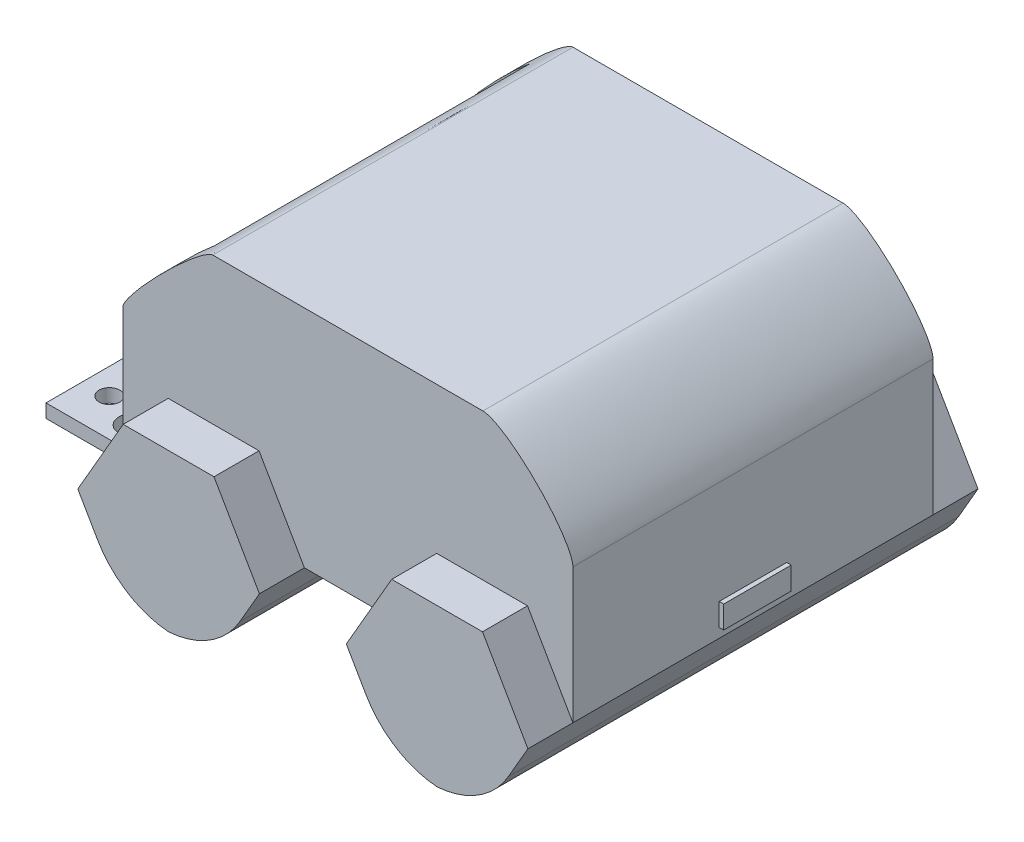
from build123d import *

# Parameters (mm, degrees)
SKETCH_1_W           = 100
SKETCH_1_H           = 80
EXTRUDE_1_DEPTH      = 50
EXTRUDE_3_DEPTH      = 10
EXTRUDE_3_DEPTH_BACK = 90
FILLET_1_SIZE        = 20
FILLET_2_R           = 20
SKETCH_7_W           = 15
SKETCH_7_H           = 5
EXTRUDE_4_DEPTH      = 1
EXTRUDE_5_DEPTH      = 10
EXTRUDE_5_DEPTH_BACK = 90
SKETCH_9_W           = 70
SKETCH_9_H           = 42
CUT_EXTRUDE_1_DEPTH  = 70
SKETCH_10_W          = 6.318012245
SKETCH_10_H          = 50
EXTRUDE_6_DEPTH      = 3
SKETCH_11_W          = 5.049227312
SKETCH_11_H          = 50
EXTRUDE_7_DEPTH      = 10
SKETCH_12_W          = 3
SKETCH_12_H          = 2
EXTRUDE_8_DEPTH      = 1
SKETCH_14_W          = 17.088208375
SKETCH_14_H          = 79.975552451
EXTRUDE_9_DEPTH      = 3
SKETCH_15_R          = 3.127439505
SKETCH_15_R_2        = 2.491358357
SKETCH_15_R_3        = 2.210086479
SKETCH_15_R_4        = 1.513903484
SKETCH_15_R_5        = 2.302487837
SKETCH_15_R_6        = 3.707833668
SKETCH_15_R_7        = 2.33587758
SKETCH_15_R_8        = 2.037847665
SKETCH_15_R_9        = 1.375167725
SKETCH_15_R_10       = 2.852513386
CUT_EXTRUDE_2_DEPTH  = 3
FILLET_7_SIZE        = 20
FILLET_8_R           = 20
EXTRUDE_10_DEPTH     = 50


with BuildPart() as part:
    # 草圖1 → 填料-伸長1 (new body)
    with BuildSketch(Plane(origin=(0, 0, 0), x_dir=(1, 0, 0), z_dir=(0, 1, 0))):
        Rectangle(SKETCH_1_W, SKETCH_1_H)
    extrude(amount=EXTRUDE_1_DEPTH)

    # 草圖4 → 填料-伸長3 (add, two sides: drawn at the far end of the back side and taken through both)
    with BuildSketch(Plane.XY.offset(40).offset(-EXTRUDE_3_DEPTH_BACK)):
        Polygon((50, 0), (39.912672295, 17.471764098), (19.738016884, 17.471764098), (9.650689179, 0), (19.738016884, -17.471764098), (39.912672295, -17.471764098), align=None)
    extrude(amount=EXTRUDE_3_DEPTH + EXTRUDE_3_DEPTH_BACK)

    # 圓角1
    # a fillet whose section is not a circle: 20 mm, written as the material it takes off along each edge
    with BuildSketch(Plane(origin=(50, 50, -90), x_dir=(0, -1, 0), z_dir=(0, 0, 1))) as fillet_1_piece_1:
        with BuildLine():
            Bezier((FILLET_1_SIZE, 0), (0, 0), (0, -FILLET_1_SIZE), weights=[1, 0.25, 1])
            Line((0, -FILLET_1_SIZE), (0, 0))
            Line((0, 0), (FILLET_1_SIZE, 0))
        make_face()
    extrude(amount=180, mode=Mode.SUBTRACT)

    # 圓角2
    # the kernel refuses this fillet: 20 mm, written as the material it takes off along each edge
    with BuildSketch(Plane(origin=(39.912672295, -17.471764098, 78.867513459), x_dir=(0.499999999999995, 0.8660254037844415, 0), z_dir=(0, 0, -1))) as fillet_2_piece_1:
        with BuildLine():
            CenterArc((FILLET_2_R * 0.57735026919, -FILLET_2_R), FILLET_2_R, 90, 60)
            Line((-FILLET_2_R * 0.288675134595, -FILLET_2_R * 0.5), (0, 0))
            Line((0, 0), (FILLET_2_R * 0.57735026919, 0))
        make_face()
    extrude(amount=157.735026919, mode=Mode.SUBTRACT)
    with BuildSketch(Plane(origin=(19.738016884, -17.471764098, 78.867513459), x_dir=(-0.5000000000000067, 0.8660254037844347, 0), z_dir=(0, 0, -1))) as fillet_2_piece_2:
        with BuildLine():
            CenterArc((FILLET_2_R * 0.57735026919, FILLET_2_R), FILLET_2_R, 210, 60)
            Line((-FILLET_2_R * 0.288675134595, FILLET_2_R * 0.5), (0, 0))
            Line((0, 0), (FILLET_2_R * 0.57735026919, 0))
        make_face()
    extrude(amount=157.735026919, mode=Mode.SUBTRACT)

    # 草圖7 → 填料-伸長4 (add)
    with BuildSketch(Plane(origin=(50, 0, 0), x_dir=(0, 0, -1), z_dir=(1, 0, 0))):
        with Locations((0, 4.59808643)):
            Rectangle(SKETCH_7_W, SKETCH_7_H)
    extrude(amount=EXTRUDE_4_DEPTH)

    # 草圖8 → 填料-伸長5 (add, two sides: drawn at the far end of the back side and taken through both)
    with BuildSketch(Plane.XY.offset(40).offset(-EXTRUDE_5_DEPTH_BACK)):
        Polygon((-9.65, 0), (-19.7375, 17.472062521), (-39.9125, 17.472062521), (-50, 0), (-39.9125, -17.472062521), (-19.7375, -17.472062521), align=None)
    extrude(amount=EXTRUDE_5_DEPTH + EXTRUDE_5_DEPTH_BACK)

    # 草圖9 → 除料-伸長1 (cut)
    with BuildSketch(Plane.ZY.offset(50)):
        with Locations((0, 26)):
            Rectangle(SKETCH_9_W, SKETCH_9_H)
    extrude(amount=-CUT_EXTRUDE_1_DEPTH, mode=Mode.SUBTRACT)

    # 草圖10 → 填料-伸長6 (add)
    with BuildSketch(Plane(origin=(0, 5, 0), x_dir=(1, 0, 0), z_dir=(0, 1, 0))):
        with Locations((11.791766566, 0)):
            Rectangle(SKETCH_10_W, SKETCH_10_H)
    extrude(amount=EXTRUDE_6_DEPTH)

    # 草圖11 → 填料-伸長7 (add)
    with BuildSketch(Plane(origin=(0, 5, 0), x_dir=(1, 0, 0), z_dir=(0, 1, 0))):
        with Locations((17.475386344, 0)):
            Rectangle(SKETCH_11_W, SKETCH_11_H)
    extrude(amount=EXTRUDE_7_DEPTH)

    # 草圖12 → 填料-伸長8 (add)
    with BuildSketch(Plane.ZY.offset(-14.950772688)):
        with Locations((-19.660528626, 13)):
            Rectangle(SKETCH_12_W, SKETCH_12_H)
    extrude(amount=EXTRUDE_8_DEPTH)

    # 草圖14 → 填料-伸長9 (add)
    with BuildSketch(Plane(origin=(0, 0, 0), x_dir=(1, 0, 0), z_dir=(0, 1, 0))):
        with Locations((-58.544104188, 0.012223774)):
            Rectangle(SKETCH_14_W, SKETCH_14_H)
    extrude(amount=EXTRUDE_9_DEPTH)

    # 草圖15 → 除料-伸長2 (cut)
    with BuildSketch(Plane(origin=(0, 3, 0), x_dir=(1, 0, 0), z_dir=(0, 1, 0))):
        with Locations(Location((-53.162249787, -34.567412257, 0), (0, 0, 270))):
            Circle(SKETCH_15_R)
        with Locations(Location((-61.348379135, -22.561089213, 0), (0, 0, 270))):
            Circle(SKETCH_15_R_2)
        with Locations(Location((-57.964779004, -16.121334126, 0), (0, 0, 270))):
            Circle(SKETCH_15_R_3)
        with Locations(Location((-55.754692526, -25.052447569, 0), (0, 0, 270))):
            Circle(SKETCH_15_R_4)
        with Locations(Location((-61.348379135, -31.620405692, 0), (0, 0, 270))):
            Circle(SKETCH_15_R_5)
        with Locations(Location((-60.584340396, 2.106447223, 0), (0, 0, 270))):
            Circle(SKETCH_15_R_6)
        with Locations(Location((-57.964779004, 20.225080181, 0), (0, 0, 270))):
            Circle(SKETCH_15_R_7)
        with Locations(Location((-55.628901425, 12.257247615, 0), (0, 0, 270))):
            Circle(SKETCH_15_R_8)
        with Locations(Location((-54.2537337, -5.861385342, 0), (0, 0, 270))):
            Circle(SKETCH_15_R_9)
        with Locations(Location((-55.628901425, 31.467364486, 0), (0, 0, 270))):
            Circle(SKETCH_15_R_10)
    extrude(amount=-CUT_EXTRUDE_2_DEPTH, mode=Mode.SUBTRACT)

    # 圓角7
    # a fillet whose section is not a circle: 20 mm, written as the material it takes off along each edge
    with BuildSketch(Plane(origin=(-50, 50, 90), x_dir=(0, -1, 0), z_dir=(0, 0, -1))) as fillet_7_piece_1:
        with BuildLine():
            Bezier((FILLET_7_SIZE, 0), (0, 0), (0, -FILLET_7_SIZE), weights=[1, 0.11785113, 1])
            Line((0, -FILLET_7_SIZE), (0, 0))
            Line((0, 0), (FILLET_7_SIZE, 0))
        make_face()
    extrude(amount=180, mode=Mode.SUBTRACT)

    # 圓角8
    # the kernel refuses this fillet: 20 mm, written as the material it takes off along each edge
    with BuildSketch(Plane(origin=(-19.7375, -17.472062521, 78.867513459), x_dir=(0.4999999999999952, 0.8660254037844414, 0), z_dir=(0, 0, -1))) as fillet_8_piece_1:
        with BuildLine():
            CenterArc((FILLET_8_R * 0.57735026919, -FILLET_8_R), FILLET_8_R, 90, 60)
            Line((-FILLET_8_R * 0.288675134595, -FILLET_8_R * 0.5), (0, 0))
            Line((0, 0), (FILLET_8_R * 0.57735026919, 0))
        make_face()
    extrude(amount=157.735026919, mode=Mode.SUBTRACT)
    with BuildSketch(Plane(origin=(-39.9125, -17.472062521, 78.867513459), x_dir=(-0.5000000000000036, 0.8660254037844366, 0), z_dir=(0, 0, -1))) as fillet_8_piece_2:
        with BuildLine():
            CenterArc((FILLET_8_R * 0.57735026919, FILLET_8_R), FILLET_8_R, 210, 60)
            Line((-FILLET_8_R * 0.288675134595, FILLET_8_R * 0.5), (0, 0))
            Line((0, 0), (FILLET_8_R * 0.57735026919, 0))
        make_face()
    extrude(amount=157.735026919, mode=Mode.SUBTRACT)

    # 草圖18 → 填料-伸長10 (add)
    with BuildSketch(Plane(origin=(0, 0, -25), x_dir=(-1, 0, 0), z_dir=(0, 0, -1))):
        with BuildLine():
            Line((-13.950772688, 12), (-14.950772688, 12))
            Line((-14.950772688, 12), (-14.950772688, 8))
            Line((-14.950772688, 8), (-8.632760443, 8))
            add(Edge.make_bspline(
                [(-13.950772688, 12), (-17.022847393, 5.423952997), (-10.668970585, 10.756901706), (-8.632760443, 8)],
                knots=[0, 0, 0, 0, 1, 1, 1, 1], degree=3))
        make_face()
    extrude(amount=-EXTRUDE_10_DEPTH)


solid = part.part
